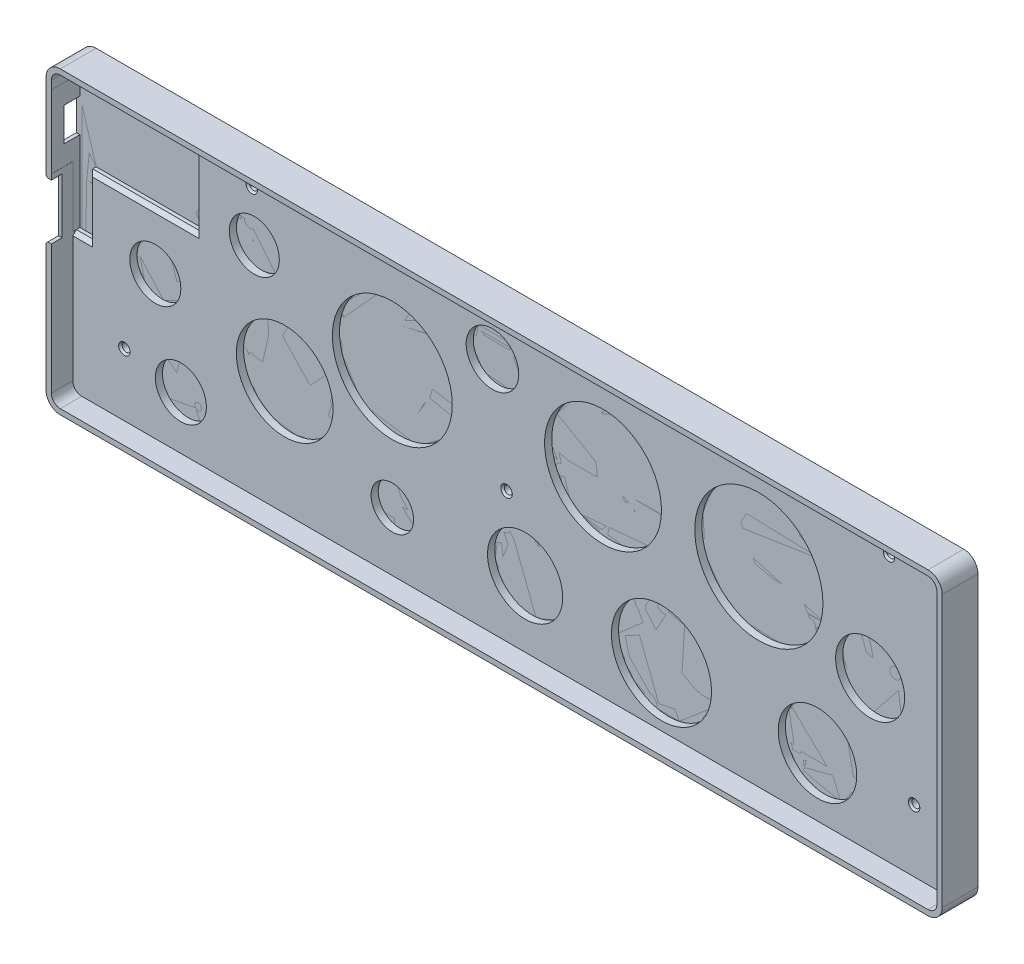
from build123d import *

# Parameters (mm, degrees)
SKETCH1_R                = 1.1
SKETCH1_R_2              = 0.95
SKETCH1_R_3              = 2.05
SKETCH1_R_4              = 1.5
SKETCH1_R_5              = 0.15
SKETCH1_R_6              = 0.5
SKETCH1_R_7              = 0.45
SKETCH1_R_8              = 1.524
SKETCH1_R_9              = 1.9939
SKETCH1_R_10             = 0.375
BOSS_EXTRUDE1_DEPTH      = 1.6
BOSS_EXTRUDE2_DEPTH      = 8
BOSS_EXTRUDE2_DEPTH_BACK = 2
BOSS_EXTRUDE5_DEPTH      = 2
BOSS_EXTRUDE5_DEPTH_BACK = 2
BOSS_EXTRUDE5_START      = 1.6
SKETCH5_R                = 1.105991344
SKETCH5_R_2              = 1.113799343
SKETCH5_R_3              = 1.1
SKETCH6_W                = 32.534762887
SKETCH6_H                = 20.354663213
CUT_EXTRUDE1_DEPTH       = 2
SKETCH7_W                = 2.5
SKETCH7_H                = 9.354663213
SKETCH7_W_2              = 2
CUT_EXTRUDE2_DEPTH       = 313.254874697
CUT_EXTRUDE3_DEPTH       = 10
CUT_EXTRUDE3_DEPTH_BACK  = 2
SKETCH9_W                = 4.56033848
SKETCH9_H                = 16.973436805
CUT_EXTRUDE4_DEPTH       = 2
SKETCH11_W               = 5
SKETCH11_H               = 15.458393228
CUT_EXTRUDE6_DEPTH       = 2
CHAMFER1_SIZE            = 0.5
CHAMFER2_SIZE            = 0.5
CHAMFER3_SIZE            = 1
CHAMFER4_SIZE            = 0.5
SKETCH14_R               = 7.140850868
SKETCH14_R_2             = 13.529089725
SKETCH14_R_3             = 16.769908871
SKETCH14_R_4             = 16.347261312
SKETCH14_R_5             = 14
SKETCH14_R_6             = 5.942662117
SKETCH14_R_7             = 10.51468553
SKETCH14_R_8             = 17.931561283
SKETCH14_R_9             = 10.983244874
SKETCH14_R_10            = 9.653898763
SKETCH14_R_11            = 7.356379062
SKETCH14_R_12            = 7.000760864
CUT_EXTRUDE8_DEPTH       = 2
CUT_EXTRUDE9_DEPTH       = 1


with BuildPart() as part:
    # Sketch1 → Boss-Extrude1 (new body)
    with BuildSketch(Plane.XY.offset(1.6)):
        with BuildLine():
            Line((342.620001494, -108.45), (99.949998506, -108.45))
            ThreePointArc((99.949998506, -108.45), (98.535786, -109.035786), (97.95, -110.449998506))
            Line((97.95, -110.449998506), (97.95, -186.250001494))
            ThreePointArc((97.95, -186.250001494), (98.535786, -187.664214), (99.949998506, -188.25))
            Line((99.949998506, -188.25), (342.620001494, -188.25))
            ThreePointArc((342.620001494, -188.25), (344.034214, -187.664214), (344.62, -186.250001494))
            Line((344.62, -186.250001494), (344.62, -110.449998506))
            ThreePointArc((344.62, -110.449998506), (344.034214, -109.035786), (342.620001494, -108.45))
        make_face()
        with Locations(Location((325.72, -114.3, 0), (0, 0, 180))):
            Circle(SKETCH1_R, mode=Mode.SUBTRACT)
        with Locations(Location((330.8, -120, 0), (0, 0, 180))):
            Circle(SKETCH1_R_2, mode=Mode.SUBTRACT)
        with Locations(Location((325.72, -120, 0), (0, 0, 180))):
            Circle(SKETCH1_R_3, mode=Mode.SUBTRACT)
        with Locations(Location((320.64, -120, 0), (0, 0, 180))):
            Circle(SKETCH1_R_2, mode=Mode.SUBTRACT)
        with Locations(Location((304.58, -120, 0), (0, 0, 180))):
            Circle(SKETCH1_R_2, mode=Mode.SUBTRACT)
        with Locations(Location((299.5, -120, 0), (0, 0, 180))):
            Circle(SKETCH1_R_3, mode=Mode.SUBTRACT)
        with Locations(Location((294.42, -120, 0), (0, 0, 180))):
            Circle(SKETCH1_R_2, mode=Mode.SUBTRACT)
        with Locations(Location((285.58, -120, 0), (0, 0, 180))):
            Circle(SKETCH1_R_2, mode=Mode.SUBTRACT)
        with Locations(Location((280.5, -120, 0), (0, 0, 180))):
            Circle(SKETCH1_R_3, mode=Mode.SUBTRACT)
        with Locations(Location((329.53, -122.54, 0), (0, 0, 180))):
            Circle(SKETCH1_R_4, mode=Mode.SUBTRACT)
        with Locations(Location((323.18, -125.08, 0), (0, 0, 180))):
            Circle(SKETCH1_R_4, mode=Mode.SUBTRACT)
        with Locations(Location((327.37, -129, 0), (0, 0, 180))):
            Circle(SKETCH1_R_5, mode=Mode.SUBTRACT)
        with Locations(Location((324.07, -129, 0), (0, 0, 180))):
            Circle(SKETCH1_R_5, mode=Mode.SUBTRACT)
        with Locations(Location((303.31, -122.54, 0), (0, 0, 180))):
            Circle(SKETCH1_R_4, mode=Mode.SUBTRACT)
        with Locations(Location((296.96, -125.08, 0), (0, 0, 180))):
            Circle(SKETCH1_R_4, mode=Mode.SUBTRACT)
        with Locations(Location((284.31, -122.54, 0), (0, 0, 180))):
            Circle(SKETCH1_R_4, mode=Mode.SUBTRACT)
        with Locations(Location((301.15, -129, 0), (0, 0, 180))):
            Circle(SKETCH1_R_5, mode=Mode.SUBTRACT)
        with Locations(Location((297.85, -129, 0), (0, 0, 180))):
            Circle(SKETCH1_R_5, mode=Mode.SUBTRACT)
        with Locations(Location((282.15, -129, 0), (0, 0, 180))):
            Circle(SKETCH1_R_5, mode=Mode.SUBTRACT)
        with Locations(Location((275.42, -120, 0), (0, 0, 180))):
            Circle(SKETCH1_R_2, mode=Mode.SUBTRACT)
        with Locations(Location((266.58, -120, 0), (0, 0, 180))):
            Circle(SKETCH1_R_2, mode=Mode.SUBTRACT)
        with Locations(Location((261.5, -120, 0), (0, 0, 180))):
            Circle(SKETCH1_R_3, mode=Mode.SUBTRACT)
        with Locations(Location((256.42, -120, 0), (0, 0, 180))):
            Circle(SKETCH1_R_2, mode=Mode.SUBTRACT)
        with Locations(Location((247.58, -120, 0), (0, 0, 180))):
            Circle(SKETCH1_R_2, mode=Mode.SUBTRACT)
        with Locations(Location((242.5, -120, 0), (0, 0, 180))):
            Circle(SKETCH1_R_3, mode=Mode.SUBTRACT)
        with Locations(Location((237.42, -120, 0), (0, 0, 180))):
            Circle(SKETCH1_R_2, mode=Mode.SUBTRACT)
        with Locations(Location((228.58, -120, 0), (0, 0, 180))):
            Circle(SKETCH1_R_2, mode=Mode.SUBTRACT)
        with Locations(Location((223.5, -120, 0), (0, 0, 180))):
            Circle(SKETCH1_R_3, mode=Mode.SUBTRACT)
        with Locations(Location((265.31, -122.54, 0), (0, 0, 180))):
            Circle(SKETCH1_R_4, mode=Mode.SUBTRACT)
        with Locations(Location((277.96, -125.08, 0), (0, 0, 180))):
            Circle(SKETCH1_R_4, mode=Mode.SUBTRACT)
        with Locations(Location((258.96, -125.08, 0), (0, 0, 180))):
            Circle(SKETCH1_R_4, mode=Mode.SUBTRACT)
        with Locations(Location((278.85, -129, 0), (0, 0, 180))):
            Circle(SKETCH1_R_5, mode=Mode.SUBTRACT)
        with Locations(Location((263.15, -129, 0), (0, 0, 180))):
            Circle(SKETCH1_R_5, mode=Mode.SUBTRACT)
        with Locations(Location((259.85, -129, 0), (0, 0, 180))):
            Circle(SKETCH1_R_5, mode=Mode.SUBTRACT)
        with Locations(Location((246.31, -122.54, 0), (0, 0, 180))):
            Circle(SKETCH1_R_4, mode=Mode.SUBTRACT)
        with Locations(Location((239.96, -125.08, 0), (0, 0, 180))):
            Circle(SKETCH1_R_4, mode=Mode.SUBTRACT)
        with Locations(Location((227.31, -122.54, 0), (0, 0, 180))):
            Circle(SKETCH1_R_4, mode=Mode.SUBTRACT)
        with Locations(Location((220.96, -125.08, 0), (0, 0, 180))):
            Circle(SKETCH1_R_4, mode=Mode.SUBTRACT)
        with Locations(Location((244.15, -129, 0), (0, 0, 180))):
            Circle(SKETCH1_R_5, mode=Mode.SUBTRACT)
        with Locations(Location((240.85, -129, 0), (0, 0, 180))):
            Circle(SKETCH1_R_5, mode=Mode.SUBTRACT)
        with Locations(Location((225.15, -129, 0), (0, 0, 180))):
            Circle(SKETCH1_R_5, mode=Mode.SUBTRACT)
        with Locations(Location((221.85, -129, 0), (0, 0, 180))):
            Circle(SKETCH1_R_5, mode=Mode.SUBTRACT)
        with Locations(Location((333.08, -139, 0), (0, 0, 180))):
            Circle(SKETCH1_R_2, mode=Mode.SUBTRACT)
        with Locations(Location((328, -139, 0), (0, 0, 180))):
            Circle(SKETCH1_R_3, mode=Mode.SUBTRACT)
        with Locations(Location((322.92, -139, 0), (0, 0, 180))):
            Circle(SKETCH1_R_2, mode=Mode.SUBTRACT)
        with Locations(Location((309.33, -139, 0), (0, 0, 180))):
            Circle(SKETCH1_R_2, mode=Mode.SUBTRACT)
        with Locations(Location((304.25, -139, 0), (0, 0, 180))):
            Circle(SKETCH1_R_3, mode=Mode.SUBTRACT)
        with Locations(Location((299.17, -139, 0), (0, 0, 180))):
            Circle(SKETCH1_R_2, mode=Mode.SUBTRACT)
        with Locations(Location((290.33, -139, 0), (0, 0, 180))):
            Circle(SKETCH1_R_2, mode=Mode.SUBTRACT)
        with Locations(Location((285.25, -139, 0), (0, 0, 180))):
            Circle(SKETCH1_R_3, mode=Mode.SUBTRACT)
        with Locations(Location((280.17, -139, 0), (0, 0, 180))):
            Circle(SKETCH1_R_2, mode=Mode.SUBTRACT)
        with Locations(Location((331.81, -141.54, 0), (0, 0, 180))):
            Circle(SKETCH1_R_4, mode=Mode.SUBTRACT)
        with Locations(Location((325.46, -144.08, 0), (0, 0, 180))):
            Circle(SKETCH1_R_4, mode=Mode.SUBTRACT)
        with Locations(Location((329.65, -148, 0), (0, 0, 180))):
            Circle(SKETCH1_R_5, mode=Mode.SUBTRACT)
        with Locations(Location((326.35, -148, 0), (0, 0, 180))):
            Circle(SKETCH1_R_5, mode=Mode.SUBTRACT)
        with Locations(Location((308.06, -141.54, 0), (0, 0, 180))):
            Circle(SKETCH1_R_4, mode=Mode.SUBTRACT)
        with Locations(Location((301.71, -144.08, 0), (0, 0, 180))):
            Circle(SKETCH1_R_4, mode=Mode.SUBTRACT)
        with Locations(Location((289.06, -141.54, 0), (0, 0, 180))):
            Circle(SKETCH1_R_4, mode=Mode.SUBTRACT)
        with Locations(Location((282.71, -144.08, 0), (0, 0, 180))):
            Circle(SKETCH1_R_4, mode=Mode.SUBTRACT)
        with Locations(Location((305.9, -148, 0), (0, 0, 180))):
            Circle(SKETCH1_R_5, mode=Mode.SUBTRACT)
        with Locations(Location((302.6, -148, 0), (0, 0, 180))):
            Circle(SKETCH1_R_5, mode=Mode.SUBTRACT)
        with Locations(Location((286.9, -148, 0), (0, 0, 180))):
            Circle(SKETCH1_R_5, mode=Mode.SUBTRACT)
        with Locations(Location((283.6, -148, 0), (0, 0, 180))):
            Circle(SKETCH1_R_5, mode=Mode.SUBTRACT)
        with Locations(Location((271.33, -139, 0), (0, 0, 180))):
            Circle(SKETCH1_R_2, mode=Mode.SUBTRACT)
        with Locations(Location((266.25, -139, 0), (0, 0, 180))):
            Circle(SKETCH1_R_3, mode=Mode.SUBTRACT)
        with Locations(Location((261.17, -139, 0), (0, 0, 180))):
            Circle(SKETCH1_R_2, mode=Mode.SUBTRACT)
        with Locations(Location((252.33, -139, 0), (0, 0, 180))):
            Circle(SKETCH1_R_2, mode=Mode.SUBTRACT)
        with Locations(Location((247.25, -139, 0), (0, 0, 180))):
            Circle(SKETCH1_R_3, mode=Mode.SUBTRACT)
        with Locations(Location((242.17, -139, 0), (0, 0, 180))):
            Circle(SKETCH1_R_2, mode=Mode.SUBTRACT)
        with Locations(Location((233.33, -139, 0), (0, 0, 180))):
            Circle(SKETCH1_R_2, mode=Mode.SUBTRACT)
        with Locations(Location((228.25, -139, 0), (0, 0, 180))):
            Circle(SKETCH1_R_3, mode=Mode.SUBTRACT)
        with Locations(Location((223.17, -139, 0), (0, 0, 180))):
            Circle(SKETCH1_R_2, mode=Mode.SUBTRACT)
        with Locations(Location((270.06, -141.54, 0), (0, 0, 180))):
            Circle(SKETCH1_R_4, mode=Mode.SUBTRACT)
        with Locations(Location((251.06, -141.54, 0), (0, 0, 180))):
            Circle(SKETCH1_R_4, mode=Mode.SUBTRACT)
        with Locations(Location((263.71, -144.08, 0), (0, 0, 180))):
            Circle(SKETCH1_R_4, mode=Mode.SUBTRACT)
        with Locations(Location((267.9, -148, 0), (0, 0, 180))):
            Circle(SKETCH1_R_5, mode=Mode.SUBTRACT)
        with Locations(Location((264.6, -148, 0), (0, 0, 180))):
            Circle(SKETCH1_R_5, mode=Mode.SUBTRACT)
        with Locations(Location((244.71, -144.08, 0), (0, 0, 180))):
            Circle(SKETCH1_R_4, mode=Mode.SUBTRACT)
        with Locations(Location((232.06, -141.54, 0), (0, 0, 180))):
            Circle(SKETCH1_R_4, mode=Mode.SUBTRACT)
        with Locations(Location((225.71, -144.08, 0), (0, 0, 180))):
            Circle(SKETCH1_R_4, mode=Mode.SUBTRACT)
        with Locations(Location((248.9, -148, 0), (0, 0, 180))):
            Circle(SKETCH1_R_5, mode=Mode.SUBTRACT)
        with Locations(Location((245.6, -148, 0), (0, 0, 180))):
            Circle(SKETCH1_R_5, mode=Mode.SUBTRACT)
        with Locations(Location((229.9, -148, 0), (0, 0, 180))):
            Circle(SKETCH1_R_5, mode=Mode.SUBTRACT)
        with Locations(Location((226.6, -148, 0), (0, 0, 180))):
            Circle(SKETCH1_R_5, mode=Mode.SUBTRACT)
        with Locations(Location((218.42, -120, 0), (0, 0, 180))):
            Circle(SKETCH1_R_2, mode=Mode.SUBTRACT)
        with Locations(Location((209.58, -120, 0), (0, 0, 180))):
            Circle(SKETCH1_R_2, mode=Mode.SUBTRACT)
        with Locations(Location((204.5, -120, 0), (0, 0, 180))):
            Circle(SKETCH1_R_3, mode=Mode.SUBTRACT)
        with Locations(Location((199.42, -120, 0), (0, 0, 180))):
            Circle(SKETCH1_R_2, mode=Mode.SUBTRACT)
        with Locations(Location((190.58, -120, 0), (0, 0, 180))):
            Circle(SKETCH1_R_2, mode=Mode.SUBTRACT)
        with Locations(Location((185.5, -120, 0), (0, 0, 180))):
            Circle(SKETCH1_R_3, mode=Mode.SUBTRACT)
        with Locations(Location((180.42, -120, 0), (0, 0, 180))):
            Circle(SKETCH1_R_2, mode=Mode.SUBTRACT)
        with Locations(Location((171.58, -120, 0), (0, 0, 180))):
            Circle(SKETCH1_R_2, mode=Mode.SUBTRACT)
        with Locations(Location((166.5, -120, 0), (0, 0, 180))):
            Circle(SKETCH1_R_3, mode=Mode.SUBTRACT)
        with Locations(Location((161.42, -120, 0), (0, 0, 180))):
            Circle(SKETCH1_R_2, mode=Mode.SUBTRACT)
        with Locations(Location((208.31, -122.54, 0), (0, 0, 180))):
            Circle(SKETCH1_R_4, mode=Mode.SUBTRACT)
        with Locations(Location((189.31, -122.54, 0), (0, 0, 180))):
            Circle(SKETCH1_R_4, mode=Mode.SUBTRACT)
        with Locations(Location((201.96, -125.08, 0), (0, 0, 180))):
            Circle(SKETCH1_R_4, mode=Mode.SUBTRACT)
        with Locations(Location((206.15, -129, 0), (0, 0, 180))):
            Circle(SKETCH1_R_5, mode=Mode.SUBTRACT)
        with Locations(Location((202.85, -129, 0), (0, 0, 180))):
            Circle(SKETCH1_R_5, mode=Mode.SUBTRACT)
        with Locations(Location((182.96, -125.08, 0), (0, 0, 180))):
            Circle(SKETCH1_R_4, mode=Mode.SUBTRACT)
        with Locations(Location((170.31, -122.54, 0), (0, 0, 180))):
            Circle(SKETCH1_R_4, mode=Mode.SUBTRACT)
        with Locations(Location((163.96, -125.08, 0), (0, 0, 180))):
            Circle(SKETCH1_R_4, mode=Mode.SUBTRACT)
        with Locations(Location((187.15, -129, 0), (0, 0, 180))):
            Circle(SKETCH1_R_5, mode=Mode.SUBTRACT)
        with Locations(Location((183.85, -129, 0), (0, 0, 180))):
            Circle(SKETCH1_R_5, mode=Mode.SUBTRACT)
        with Locations(Location((168.15, -129, 0), (0, 0, 180))):
            Circle(SKETCH1_R_5, mode=Mode.SUBTRACT)
        with Locations(Location((164.85, -129, 0), (0, 0, 180))):
            Circle(SKETCH1_R_5, mode=Mode.SUBTRACT)
        with Locations(Location((147.5, -114.3, 0), (0, 0, 180))):
            Circle(SKETCH1_R, mode=Mode.SUBTRACT)
        with Locations(Location((129.49, -115.23, 0), (0, 0, 180))):
            Circle(SKETCH1_R_6, mode=Mode.SUBTRACT)
        with Locations(Location((152.58, -120, 0), (0, 0, 180))):
            Circle(SKETCH1_R_2, mode=Mode.SUBTRACT)
        with Locations(Location((147.5, -120, 0), (0, 0, 180))):
            Circle(SKETCH1_R_3, mode=Mode.SUBTRACT)
        with Locations(Location((142.42, -120, 0), (0, 0, 180))):
            Circle(SKETCH1_R_2, mode=Mode.SUBTRACT)
        with Locations(Location((133.58, -120, 0), (0, 0, 180))):
            Circle(SKETCH1_R_2, mode=Mode.SUBTRACT)
        with Locations(Location((126.95, -115.23, 0), (0, 0, 180))):
            Circle(SKETCH1_R_6, mode=Mode.SUBTRACT)
        with Locations(Location((124.41, -115.23, 0), (0, 0, 180))):
            Circle(SKETCH1_R_6, mode=Mode.SUBTRACT)
        with Locations(Location((121.87, -115.23, 0), (0, 0, 180))):
            Circle(SKETCH1_R_6, mode=Mode.SUBTRACT)
        with Locations(Location((119.33, -115.23, 0), (0, 0, 180))):
            Circle(SKETCH1_R_6, mode=Mode.SUBTRACT)
        with Locations(Location((116.79, -115.23, 0), (0, 0, 180))):
            Circle(SKETCH1_R_6, mode=Mode.SUBTRACT)
        with Locations(Location((114.25, -115.23, 0), (0, 0, 180))):
            Circle(SKETCH1_R_6, mode=Mode.SUBTRACT)
        with Locations(Location((111.71, -115.23, 0), (0, 0, 180))):
            Circle(SKETCH1_R_6, mode=Mode.SUBTRACT)
        with Locations(Location((109.17, -115.23, 0), (0, 0, 180))):
            Circle(SKETCH1_R_6, mode=Mode.SUBTRACT)
        with Locations(Location((106.63, -115.23, 0), (0, 0, 180))):
            Circle(SKETCH1_R_6, mode=Mode.SUBTRACT)
        with Locations(Location((104.09, -115.23, 0), (0, 0, 180))):
            Circle(SKETCH1_R_6, mode=Mode.SUBTRACT)
        with Locations(Location((101.55, -115.23, 0), (0, 0, 180))):
            Circle(SKETCH1_R_6, mode=Mode.SUBTRACT)
        with Locations(Location((128.5, -120, 0), (0, 0, 180))):
            Circle(SKETCH1_R_3, mode=Mode.SUBTRACT)
        with Locations(Location((123.42, -120, 0), (0, 0, 180))):
            Circle(SKETCH1_R_2, mode=Mode.SUBTRACT)
        with Locations(Location((114.58, -120, 0), (0, 0, 180))):
            Circle(SKETCH1_R_2, mode=Mode.SUBTRACT)
        with Locations(Location((120.05, -121.150002, 0), (0, 0, 180))):
            Circle(SKETCH1_R_5, mode=Mode.SUBTRACT)
        with Locations(Location((109.5, -120, 0), (0, 0, 180))):
            Circle(SKETCH1_R_3, mode=Mode.SUBTRACT)
        with Locations(Location((104.42, -120, 0), (0, 0, 180))):
            Circle(SKETCH1_R_2, mode=Mode.SUBTRACT)
        with Locations(Location((100.875, -120.825002, 0), (0, 0, 180))):
            Circle(SKETCH1_R_5, mode=Mode.SUBTRACT)
        with Locations(Location((151.31, -122.54, 0), (0, 0, 180))):
            Circle(SKETCH1_R_4, mode=Mode.SUBTRACT)
        with Locations(Location((144.96, -125.08, 0), (0, 0, 180))):
            Circle(SKETCH1_R_4, mode=Mode.SUBTRACT)
        with Locations(Location((132.31, -122.54, 0), (0, 0, 180))):
            Circle(SKETCH1_R_4, mode=Mode.SUBTRACT)
        with Locations(Location((149.15, -129, 0), (0, 0, 180))):
            Circle(SKETCH1_R_5, mode=Mode.SUBTRACT)
        with Locations(Location((145.85, -129, 0), (0, 0, 180))):
            Circle(SKETCH1_R_5, mode=Mode.SUBTRACT)
        with Locations(Location((129.49, -130.47, 0), (0, 0, 180))):
            Circle(SKETCH1_R_6, mode=Mode.SUBTRACT)
        with Locations(Location((120.05, -124.449998, 0), (0, 0, 180))):
            Circle(SKETCH1_R_5, mode=Mode.SUBTRACT)
        with Locations(Location((125.96, -125.08, 0), (0, 0, 180))):
            Circle(SKETCH1_R_4, mode=Mode.SUBTRACT)
        with Locations(Location((113.31, -122.54, 0), (0, 0, 180))):
            Circle(SKETCH1_R_4, mode=Mode.SUBTRACT)
        with Locations(Location((100.875, -124.124998, 0), (0, 0, 180))):
            Circle(SKETCH1_R_5, mode=Mode.SUBTRACT)
        with Locations(Location((106.96, -125.08, 0), (0, 0, 180))):
            Circle(SKETCH1_R_4, mode=Mode.SUBTRACT)
        with Locations(Location((126.95, -130.47, 0), (0, 0, 180))):
            Circle(SKETCH1_R_6, mode=Mode.SUBTRACT)
        with Locations(Location((124.41, -130.47, 0), (0, 0, 180))):
            Circle(SKETCH1_R_6, mode=Mode.SUBTRACT)
        with Locations(Location((121.87, -130.47, 0), (0, 0, 180))):
            Circle(SKETCH1_R_6, mode=Mode.SUBTRACT)
        with Locations(Location((119.33, -130.47, 0), (0, 0, 180))):
            Circle(SKETCH1_R_6, mode=Mode.SUBTRACT)
        with Locations(Location((116.79, -130.47, 0), (0, 0, 180))):
            Circle(SKETCH1_R_6, mode=Mode.SUBTRACT)
        with Locations(Location((114.25, -130.47, 0), (0, 0, 180))):
            Circle(SKETCH1_R_6, mode=Mode.SUBTRACT)
        with Locations(Location((111.71, -130.47, 0), (0, 0, 180))):
            Circle(SKETCH1_R_6, mode=Mode.SUBTRACT)
        with Locations(Location((109.17, -130.47, 0), (0, 0, 180))):
            Circle(SKETCH1_R_6, mode=Mode.SUBTRACT)
        with Locations(Location((106.63, -130.47, 0), (0, 0, 180))):
            Circle(SKETCH1_R_6, mode=Mode.SUBTRACT)
        with Locations(Location((104.09, -130.47, 0), (0, 0, 180))):
            Circle(SKETCH1_R_6, mode=Mode.SUBTRACT)
        with Locations(Location((101.55, -130.47, 0), (0, 0, 180))):
            Circle(SKETCH1_R_6, mode=Mode.SUBTRACT)
        with Locations(Location((214.33, -139, 0), (0, 0, 180))):
            Circle(SKETCH1_R_2, mode=Mode.SUBTRACT)
        with Locations(Location((209.25, -139, 0), (0, 0, 180))):
            Circle(SKETCH1_R_3, mode=Mode.SUBTRACT)
        with Locations(Location((204.17, -139, 0), (0, 0, 180))):
            Circle(SKETCH1_R_2, mode=Mode.SUBTRACT)
        with Locations(Location((195.33, -139, 0), (0, 0, 180))):
            Circle(SKETCH1_R_2, mode=Mode.SUBTRACT)
        with Locations(Location((190.25, -139, 0), (0, 0, 180))):
            Circle(SKETCH1_R_3, mode=Mode.SUBTRACT)
        with Locations(Location((185.17, -139, 0), (0, 0, 180))):
            Circle(SKETCH1_R_2, mode=Mode.SUBTRACT)
        with Locations(Location((176.33, -139, 0), (0, 0, 180))):
            Circle(SKETCH1_R_2, mode=Mode.SUBTRACT)
        with Locations(Location((171.25, -139, 0), (0, 0, 180))):
            Circle(SKETCH1_R_3, mode=Mode.SUBTRACT)
        with Locations(Location((166.17, -139, 0), (0, 0, 180))):
            Circle(SKETCH1_R_2, mode=Mode.SUBTRACT)
        with Locations(Location((213.06, -141.54, 0), (0, 0, 180))):
            Circle(SKETCH1_R_4, mode=Mode.SUBTRACT)
        with Locations(Location((206.71, -144.08, 0), (0, 0, 180))):
            Circle(SKETCH1_R_4, mode=Mode.SUBTRACT)
        with Locations(Location((194.06, -141.54, 0), (0, 0, 180))):
            Circle(SKETCH1_R_4, mode=Mode.SUBTRACT)
        with Locations(Location((210.9, -148, 0), (0, 0, 180))):
            Circle(SKETCH1_R_5, mode=Mode.SUBTRACT)
        with Locations(Location((207.6, -148, 0), (0, 0, 180))):
            Circle(SKETCH1_R_5, mode=Mode.SUBTRACT)
        with Locations(Location((191.9, -148, 0), (0, 0, 180))):
            Circle(SKETCH1_R_5, mode=Mode.SUBTRACT)
        with Locations(Location((175.06, -141.54, 0), (0, 0, 180))):
            Circle(SKETCH1_R_4, mode=Mode.SUBTRACT)
        with Locations(Location((187.71, -144.08, 0), (0, 0, 180))):
            Circle(SKETCH1_R_4, mode=Mode.SUBTRACT)
        with Locations(Location((168.71, -144.08, 0), (0, 0, 180))):
            Circle(SKETCH1_R_4, mode=Mode.SUBTRACT)
        with Locations(Location((188.6, -148, 0), (0, 0, 180))):
            Circle(SKETCH1_R_5, mode=Mode.SUBTRACT)
        with Locations(Location((172.9, -148, 0), (0, 0, 180))):
            Circle(SKETCH1_R_5, mode=Mode.SUBTRACT)
        with Locations(Location((169.6, -148, 0), (0, 0, 180))):
            Circle(SKETCH1_R_5, mode=Mode.SUBTRACT)
        with Locations(Location((157.33, -139, 0), (0, 0, 180))):
            Circle(SKETCH1_R_2, mode=Mode.SUBTRACT)
        with Locations(Location((152.25, -139, 0), (0, 0, 180))):
            Circle(SKETCH1_R_3, mode=Mode.SUBTRACT)
        with Locations(Location((147.17, -139, 0), (0, 0, 180))):
            Circle(SKETCH1_R_2, mode=Mode.SUBTRACT)
        with Locations(Location((138.33, -139, 0), (0, 0, 180))):
            Circle(SKETCH1_R_2, mode=Mode.SUBTRACT)
        with Locations(Location((133.25, -139, 0), (0, 0, 180))):
            Circle(SKETCH1_R_3, mode=Mode.SUBTRACT)
        with Locations(Location((128.17, -139, 0), (0, 0, 180))):
            Circle(SKETCH1_R_2, mode=Mode.SUBTRACT)
        with Locations(Location((116.955, -139, 0), (0, 0, 180))):
            Circle(SKETCH1_R_2, mode=Mode.SUBTRACT)
        with Locations(Location((99.78, -137.775, 0), (0, 0, 180))):
            Circle(SKETCH1_R_7, mode=Mode.SUBTRACT)
        with Locations(Location((111.875, -139, 0), (0, 0, 180))):
            Circle(SKETCH1_R_3, mode=Mode.SUBTRACT)
        with Locations(Location((106.795, -139, 0), (0, 0, 180))):
            Circle(SKETCH1_R_2, mode=Mode.SUBTRACT)
        with Locations(Location((99.78, -140.775, 0), (0, 0, 180))):
            Circle(SKETCH1_R_7, mode=Mode.SUBTRACT)
        with Locations(Location((156.06, -141.54, 0), (0, 0, 180))):
            Circle(SKETCH1_R_4, mode=Mode.SUBTRACT)
        with Locations(Location((149.71, -144.08, 0), (0, 0, 180))):
            Circle(SKETCH1_R_4, mode=Mode.SUBTRACT)
        with Locations(Location((137.06, -141.54, 0), (0, 0, 180))):
            Circle(SKETCH1_R_4, mode=Mode.SUBTRACT)
        with Locations(Location((130.71, -144.08, 0), (0, 0, 180))):
            Circle(SKETCH1_R_4, mode=Mode.SUBTRACT)
        with Locations(Location((153.9, -148, 0), (0, 0, 180))):
            Circle(SKETCH1_R_5, mode=Mode.SUBTRACT)
        with Locations(Location((150.6, -148, 0), (0, 0, 180))):
            Circle(SKETCH1_R_5, mode=Mode.SUBTRACT)
        with Locations(Location((134.9, -148, 0), (0, 0, 180))):
            Circle(SKETCH1_R_5, mode=Mode.SUBTRACT)
        with Locations(Location((131.6, -148, 0), (0, 0, 180))):
            Circle(SKETCH1_R_5, mode=Mode.SUBTRACT)
        with Locations(Location((115.685, -141.54, 0), (0, 0, 180))):
            Circle(SKETCH1_R_4, mode=Mode.SUBTRACT)
        with Locations(Location((109.335, -144.08, 0), (0, 0, 180))):
            Circle(SKETCH1_R_4, mode=Mode.SUBTRACT)
        with Locations(Location((113.525, -148, 0), (0, 0, 180))):
            Circle(SKETCH1_R_5, mode=Mode.SUBTRACT)
        with Locations(Location((110.225, -148, 0), (0, 0, 180))):
            Circle(SKETCH1_R_5, mode=Mode.SUBTRACT)
        with Locations(Location((337.83, -158, 0), (0, 0, 180))):
            Circle(SKETCH1_R_2, mode=Mode.SUBTRACT)
        with Locations(Location((332.75, -158, 0), (0, 0, 180))):
            Circle(SKETCH1_R_3, mode=Mode.SUBTRACT)
        with Locations(Location((327.67, -158, 0), (0, 0, 180))):
            Circle(SKETCH1_R_2, mode=Mode.SUBTRACT)
        with Locations(Location((318.83, -158, 0), (0, 0, 180))):
            Circle(SKETCH1_R_2, mode=Mode.SUBTRACT)
        with Locations(Location((313.75, -158, 0), (0, 0, 180))):
            Circle(SKETCH1_R_3, mode=Mode.SUBTRACT)
        with Locations(Location((308.67, -158, 0), (0, 0, 180))):
            Circle(SKETCH1_R_2, mode=Mode.SUBTRACT)
        with Locations(Location((299.83, -158, 0), (0, 0, 180))):
            Circle(SKETCH1_R_2, mode=Mode.SUBTRACT)
        with Locations(Location((294.75, -158, 0), (0, 0, 180))):
            Circle(SKETCH1_R_3, mode=Mode.SUBTRACT)
        with Locations(Location((289.67, -158, 0), (0, 0, 180))):
            Circle(SKETCH1_R_2, mode=Mode.SUBTRACT)
        with Locations(Location((280.83, -158, 0), (0, 0, 180))):
            Circle(SKETCH1_R_2, mode=Mode.SUBTRACT)
        with Locations(Location((336.56, -160.54, 0), (0, 0, 180))):
            Circle(SKETCH1_R_4, mode=Mode.SUBTRACT)
        with Locations(Location((330.21, -163.08, 0), (0, 0, 180))):
            Circle(SKETCH1_R_4, mode=Mode.SUBTRACT)
        with Locations(Location((317.56, -160.54, 0), (0, 0, 180))):
            Circle(SKETCH1_R_4, mode=Mode.SUBTRACT)
        with Locations(Location((311.21, -163.08, 0), (0, 0, 180))):
            Circle(SKETCH1_R_4, mode=Mode.SUBTRACT)
        with Locations(Location((334.4, -167, 0), (0, 0, 180))):
            Circle(SKETCH1_R_5, mode=Mode.SUBTRACT)
        with Locations(Location((331.1, -167, 0), (0, 0, 180))):
            Circle(SKETCH1_R_5, mode=Mode.SUBTRACT)
        with Locations(Location((315.4, -167, 0), (0, 0, 180))):
            Circle(SKETCH1_R_5, mode=Mode.SUBTRACT)
        with Locations(Location((312.1, -167, 0), (0, 0, 180))):
            Circle(SKETCH1_R_5, mode=Mode.SUBTRACT)
        with Locations(Location((298.56, -160.54, 0), (0, 0, 180))):
            Circle(SKETCH1_R_4, mode=Mode.SUBTRACT)
        with Locations(Location((279.56, -160.54, 0), (0, 0, 180))):
            Circle(SKETCH1_R_4, mode=Mode.SUBTRACT)
        with Locations(Location((292.21, -163.08, 0), (0, 0, 180))):
            Circle(SKETCH1_R_4, mode=Mode.SUBTRACT)
        with Locations(Location((296.4, -167, 0), (0, 0, 180))):
            Circle(SKETCH1_R_5, mode=Mode.SUBTRACT)
        with Locations(Location((293.1, -167, 0), (0, 0, 180))):
            Circle(SKETCH1_R_5, mode=Mode.SUBTRACT)
        with Locations(Location((275.75, -158, 0), (0, 0, 180))):
            Circle(SKETCH1_R_3, mode=Mode.SUBTRACT)
        with Locations(Location((270.67, -158, 0), (0, 0, 180))):
            Circle(SKETCH1_R_2, mode=Mode.SUBTRACT)
        with Locations(Location((261.83, -158, 0), (0, 0, 180))):
            Circle(SKETCH1_R_2, mode=Mode.SUBTRACT)
        with Locations(Location((256.75, -158, 0), (0, 0, 180))):
            Circle(SKETCH1_R_3, mode=Mode.SUBTRACT)
        with Locations(Location((251.67, -158, 0), (0, 0, 180))):
            Circle(SKETCH1_R_2, mode=Mode.SUBTRACT)
        with Locations(Location((242.83, -158, 0), (0, 0, 180))):
            Circle(SKETCH1_R_2, mode=Mode.SUBTRACT)
        with Locations(Location((237.75, -158, 0), (0, 0, 180))):
            Circle(SKETCH1_R_3, mode=Mode.SUBTRACT)
        with Locations(Location((232.67, -158, 0), (0, 0, 180))):
            Circle(SKETCH1_R_2, mode=Mode.SUBTRACT)
        with Locations(Location((223.83, -158, 0), (0, 0, 180))):
            Circle(SKETCH1_R_2, mode=Mode.SUBTRACT)
        with Locations(Location((273.21, -163.08, 0), (0, 0, 180))):
            Circle(SKETCH1_R_4, mode=Mode.SUBTRACT)
        with Locations(Location((260.56, -160.54, 0), (0, 0, 180))):
            Circle(SKETCH1_R_4, mode=Mode.SUBTRACT)
        with Locations(Location((254.21, -163.08, 0), (0, 0, 180))):
            Circle(SKETCH1_R_4, mode=Mode.SUBTRACT)
        with Locations(Location((277.4, -167, 0), (0, 0, 180))):
            Circle(SKETCH1_R_5, mode=Mode.SUBTRACT)
        with Locations(Location((274.1, -167, 0), (0, 0, 180))):
            Circle(SKETCH1_R_5, mode=Mode.SUBTRACT)
        with Locations(Location((258.4, -167, 0), (0, 0, 180))):
            Circle(SKETCH1_R_5, mode=Mode.SUBTRACT)
        with Locations(Location((255.1, -167, 0), (0, 0, 180))):
            Circle(SKETCH1_R_5, mode=Mode.SUBTRACT)
        with Locations(Location((241.56, -160.54, 0), (0, 0, 180))):
            Circle(SKETCH1_R_4, mode=Mode.SUBTRACT)
        with Locations(Location((235.21, -163.08, 0), (0, 0, 180))):
            Circle(SKETCH1_R_4, mode=Mode.SUBTRACT)
        with Locations(Location((222.56, -160.54, 0), (0, 0, 180))):
            Circle(SKETCH1_R_4, mode=Mode.SUBTRACT)
        with Locations(Location((239.4, -167, 0), (0, 0, 180))):
            Circle(SKETCH1_R_5, mode=Mode.SUBTRACT)
        with Locations(Location((236.1, -167, 0), (0, 0, 180))):
            Circle(SKETCH1_R_5, mode=Mode.SUBTRACT)
        with Locations(Location((220.4, -167, 0), (0, 0, 180))):
            Circle(SKETCH1_R_5, mode=Mode.SUBTRACT)
        with Locations(Location((332.75, -171.3, 0), (0, 0, 180))):
            Circle(SKETCH1_R, mode=Mode.SUBTRACT)
        with Locations(Location((337.83, -177, 0), (0, 0, 180))):
            Circle(SKETCH1_R_2, mode=Mode.SUBTRACT)
        with Locations(Location((332.75, -177, 0), (0, 0, 180))):
            Circle(SKETCH1_R_3, mode=Mode.SUBTRACT)
        with Locations(Location((327.67, -177, 0), (0, 0, 180))):
            Circle(SKETCH1_R_2, mode=Mode.SUBTRACT)
        with Locations(Location((318.83, -177, 0), (0, 0, 180))):
            Circle(SKETCH1_R_2, mode=Mode.SUBTRACT)
        with Locations(Location((313.75, -177, 0), (0, 0, 180))):
            Circle(SKETCH1_R_3, mode=Mode.SUBTRACT)
        with Locations(Location((308.67, -177, 0), (0, 0, 180))):
            Circle(SKETCH1_R_2, mode=Mode.SUBTRACT)
        with Locations(Location((299.83, -177, 0), (0, 0, 180))):
            Circle(SKETCH1_R_2, mode=Mode.SUBTRACT)
        with Locations(Location((294.75, -177, 0), (0, 0, 180))):
            Circle(SKETCH1_R_3, mode=Mode.SUBTRACT)
        with Locations(Location((289.67, -177, 0), (0, 0, 180))):
            Circle(SKETCH1_R_2, mode=Mode.SUBTRACT)
        with Locations(Location((280.83, -177, 0), (0, 0, 180))):
            Circle(SKETCH1_R_2, mode=Mode.SUBTRACT)
        with Locations(Location((336.56, -179.54, 0), (0, 0, 180))):
            Circle(SKETCH1_R_4, mode=Mode.SUBTRACT)
        with Locations(Location((330.21, -182.08, 0), (0, 0, 180))):
            Circle(SKETCH1_R_4, mode=Mode.SUBTRACT)
        with Locations(Location((317.56, -179.54, 0), (0, 0, 180))):
            Circle(SKETCH1_R_4, mode=Mode.SUBTRACT)
        with Locations(Location((311.21, -182.08, 0), (0, 0, 180))):
            Circle(SKETCH1_R_4, mode=Mode.SUBTRACT)
        with Locations(Location((334.4, -186, 0), (0, 0, 180))):
            Circle(SKETCH1_R_5, mode=Mode.SUBTRACT)
        with Locations(Location((331.1, -186, 0), (0, 0, 180))):
            Circle(SKETCH1_R_5, mode=Mode.SUBTRACT)
        with Locations(Location((315.4, -186, 0), (0, 0, 180))):
            Circle(SKETCH1_R_5, mode=Mode.SUBTRACT)
        with Locations(Location((312.1, -186, 0), (0, 0, 180))):
            Circle(SKETCH1_R_5, mode=Mode.SUBTRACT)
        with Locations(Location((298.56, -179.54, 0), (0, 0, 180))):
            Circle(SKETCH1_R_4, mode=Mode.SUBTRACT)
        with Locations(Location((279.56, -179.54, 0), (0, 0, 180))):
            Circle(SKETCH1_R_4, mode=Mode.SUBTRACT)
        with Locations(Location((292.21, -182.08, 0), (0, 0, 180))):
            Circle(SKETCH1_R_4, mode=Mode.SUBTRACT)
        with Locations(Location((296.4, -186, 0), (0, 0, 180))):
            Circle(SKETCH1_R_5, mode=Mode.SUBTRACT)
        with Locations(Location((293.1, -186, 0), (0, 0, 180))):
            Circle(SKETCH1_R_5, mode=Mode.SUBTRACT)
        with Locations(Location((256.813, -170.015, 0), (0, 0, 180))):
            Circle(SKETCH1_R_8, mode=Mode.SUBTRACT)
        with Locations(Location((275.75, -177, 0), (0, 0, 180))):
            Circle(SKETCH1_R_3, mode=Mode.SUBTRACT)
        with Locations(Location((270.67, -177, 0), (0, 0, 180))):
            Circle(SKETCH1_R_2, mode=Mode.SUBTRACT)
        with Locations(Location((249.955, -177, 0), (0, 0, 180))):
            Circle(SKETCH1_R_2, mode=Mode.SUBTRACT)
        with Locations(Location((232.937, -170.015, 0), (0, 0, 180))):
            Circle(SKETCH1_R_8, mode=Mode.SUBTRACT)
        with Locations(Location((244.875, -177, 0), (0, 0, 180))):
            Circle(SKETCH1_R_3, mode=Mode.SUBTRACT)
        with Locations(Location((239.795, -177, 0), (0, 0, 180))):
            Circle(SKETCH1_R_2, mode=Mode.SUBTRACT)
        with Locations(Location((273.21, -182.08, 0), (0, 0, 180))):
            Circle(SKETCH1_R_4, mode=Mode.SUBTRACT)
        with Locations(Location((277.4, -186, 0), (0, 0, 180))):
            Circle(SKETCH1_R_5, mode=Mode.SUBTRACT)
        with Locations(Location((274.1, -186, 0), (0, 0, 180))):
            Circle(SKETCH1_R_5, mode=Mode.SUBTRACT)
        with Locations(Location((256.813, -185.225, 0), (0, 0, 180))):
            Circle(SKETCH1_R_9, mode=Mode.SUBTRACT)
        with Locations(Location((248.685, -179.54, 0), (0, 0, 180))):
            Circle(SKETCH1_R_4, mode=Mode.SUBTRACT)
        with Locations(Location((242.335, -182.08, 0), (0, 0, 180))):
            Circle(SKETCH1_R_4, mode=Mode.SUBTRACT)
        with Locations(Location((246.525, -186, 0), (0, 0, 180))):
            Circle(SKETCH1_R_5, mode=Mode.SUBTRACT)
        with Locations(Location((243.225, -186, 0), (0, 0, 180))):
            Circle(SKETCH1_R_5, mode=Mode.SUBTRACT)
        with Locations(Location((232.937, -185.225, 0), (0, 0, 180))):
            Circle(SKETCH1_R_9, mode=Mode.SUBTRACT)
        with Locations(Location((218.75, -152.3, 0), (0, 0, 180))):
            Circle(SKETCH1_R, mode=Mode.SUBTRACT)
        with Locations(Location((218.75, -158, 0), (0, 0, 180))):
            Circle(SKETCH1_R_3, mode=Mode.SUBTRACT)
        with Locations(Location((213.67, -158, 0), (0, 0, 180))):
            Circle(SKETCH1_R_2, mode=Mode.SUBTRACT)
        with Locations(Location((204.83, -158, 0), (0, 0, 180))):
            Circle(SKETCH1_R_2, mode=Mode.SUBTRACT)
        with Locations(Location((199.75, -158, 0), (0, 0, 180))):
            Circle(SKETCH1_R_3, mode=Mode.SUBTRACT)
        with Locations(Location((194.67, -158, 0), (0, 0, 180))):
            Circle(SKETCH1_R_2, mode=Mode.SUBTRACT)
        with Locations(Location((185.83, -158, 0), (0, 0, 180))):
            Circle(SKETCH1_R_2, mode=Mode.SUBTRACT)
        with Locations(Location((180.75, -158, 0), (0, 0, 180))):
            Circle(SKETCH1_R_3, mode=Mode.SUBTRACT)
        with Locations(Location((175.67, -158, 0), (0, 0, 180))):
            Circle(SKETCH1_R_2, mode=Mode.SUBTRACT)
        with Locations(Location((166.83, -158, 0), (0, 0, 180))):
            Circle(SKETCH1_R_2, mode=Mode.SUBTRACT)
        with Locations(Location((161.75, -158, 0), (0, 0, 180))):
            Circle(SKETCH1_R_3, mode=Mode.SUBTRACT)
        with Locations(Location((216.21, -163.08, 0), (0, 0, 180))):
            Circle(SKETCH1_R_4, mode=Mode.SUBTRACT)
        with Locations(Location((203.56, -160.54, 0), (0, 0, 180))):
            Circle(SKETCH1_R_4, mode=Mode.SUBTRACT)
        with Locations(Location((197.21, -163.08, 0), (0, 0, 180))):
            Circle(SKETCH1_R_4, mode=Mode.SUBTRACT)
        with Locations(Location((217.1, -167, 0), (0, 0, 180))):
            Circle(SKETCH1_R_5, mode=Mode.SUBTRACT)
        with Locations(Location((201.4, -167, 0), (0, 0, 180))):
            Circle(SKETCH1_R_5, mode=Mode.SUBTRACT)
        with Locations(Location((198.1, -167, 0), (0, 0, 180))):
            Circle(SKETCH1_R_5, mode=Mode.SUBTRACT)
        with Locations(Location((184.56, -160.54, 0), (0, 0, 180))):
            Circle(SKETCH1_R_4, mode=Mode.SUBTRACT)
        with Locations(Location((178.21, -163.08, 0), (0, 0, 180))):
            Circle(SKETCH1_R_4, mode=Mode.SUBTRACT)
        with Locations(Location((165.56, -160.54, 0), (0, 0, 180))):
            Circle(SKETCH1_R_4, mode=Mode.SUBTRACT)
        with Locations(Location((159.21, -163.08, 0), (0, 0, 180))):
            Circle(SKETCH1_R_4, mode=Mode.SUBTRACT)
        with Locations(Location((182.4, -167, 0), (0, 0, 180))):
            Circle(SKETCH1_R_5, mode=Mode.SUBTRACT)
        with Locations(Location((179.1, -167, 0), (0, 0, 180))):
            Circle(SKETCH1_R_5, mode=Mode.SUBTRACT)
        with Locations(Location((163.4, -167, 0), (0, 0, 180))):
            Circle(SKETCH1_R_5, mode=Mode.SUBTRACT)
        with Locations(Location((160.1, -167, 0), (0, 0, 180))):
            Circle(SKETCH1_R_5, mode=Mode.SUBTRACT)
        with Locations(Location((130.6, -154.325, 0), (0, 0, 180))):
            Circle(SKETCH1_R_10, mode=Mode.SUBTRACT)
        with Locations(Location((156.67, -158, 0), (0, 0, 180))):
            Circle(SKETCH1_R_2, mode=Mode.SUBTRACT)
        with Locations(Location((147.83, -158, 0), (0, 0, 180))):
            Circle(SKETCH1_R_2, mode=Mode.SUBTRACT)
        with Locations(Location((142.75, -158, 0), (0, 0, 180))):
            Circle(SKETCH1_R_3, mode=Mode.SUBTRACT)
        with Locations(Location((137.67, -158, 0), (0, 0, 180))):
            Circle(SKETCH1_R_2, mode=Mode.SUBTRACT)
        with Locations(Location((128.6, -154.325, 0), (0, 0, 180))):
            Circle(SKETCH1_R_10, mode=Mode.SUBTRACT)
        with Locations(Location((121.705, -158, 0), (0, 0, 180))):
            Circle(SKETCH1_R_2, mode=Mode.SUBTRACT)
        with Locations(Location((116.625, -158, 0), (0, 0, 180))):
            Circle(SKETCH1_R_3, mode=Mode.SUBTRACT)
        with Locations(Location((111.545, -158, 0), (0, 0, 180))):
            Circle(SKETCH1_R_2, mode=Mode.SUBTRACT)
        with Locations(Location((146.56, -160.54, 0), (0, 0, 180))):
            Circle(SKETCH1_R_4, mode=Mode.SUBTRACT)
        with Locations(Location((140.21, -163.08, 0), (0, 0, 180))):
            Circle(SKETCH1_R_4, mode=Mode.SUBTRACT)
        with Locations(Location((144.4, -167, 0), (0, 0, 180))):
            Circle(SKETCH1_R_5, mode=Mode.SUBTRACT)
        with Locations(Location((141.1, -167, 0), (0, 0, 180))):
            Circle(SKETCH1_R_5, mode=Mode.SUBTRACT)
        with Locations(Location((120.435, -160.54, 0), (0, 0, 180))):
            Circle(SKETCH1_R_4, mode=Mode.SUBTRACT)
        with Locations(Location((114.085, -163.08, 0), (0, 0, 180))):
            Circle(SKETCH1_R_4, mode=Mode.SUBTRACT)
        with Locations(Location((118.275, -167, 0), (0, 0, 180))):
            Circle(SKETCH1_R_5, mode=Mode.SUBTRACT)
        with Locations(Location((114.975, -167, 0), (0, 0, 180))):
            Circle(SKETCH1_R_5, mode=Mode.SUBTRACT)
        with Locations(Location((209.313, -170.04, 0), (0, 0, 180))):
            Circle(SKETCH1_R_8, mode=Mode.SUBTRACT)
        with Locations(Location((202.455, -177, 0), (0, 0, 180))):
            Circle(SKETCH1_R_2, mode=Mode.SUBTRACT)
        with Locations(Location((197.375, -177, 0), (0, 0, 180))):
            Circle(SKETCH1_R_3, mode=Mode.SUBTRACT)
        with Locations(Location((192.295, -177, 0), (0, 0, 180))):
            Circle(SKETCH1_R_2, mode=Mode.SUBTRACT)
        with Locations(Location((185.437, -170.04, 0), (0, 0, 180))):
            Circle(SKETCH1_R_8, mode=Mode.SUBTRACT)
        with Locations(Location((164.455, -177, 0), (0, 0, 180))):
            Circle(SKETCH1_R_2, mode=Mode.SUBTRACT)
        with Locations(Location((159.375, -177, 0), (0, 0, 180))):
            Circle(SKETCH1_R_3, mode=Mode.SUBTRACT)
        with Locations(Location((201.185, -179.54, 0), (0, 0, 180))):
            Circle(SKETCH1_R_4, mode=Mode.SUBTRACT)
        with Locations(Location((194.835, -182.08, 0), (0, 0, 180))):
            Circle(SKETCH1_R_4, mode=Mode.SUBTRACT)
        with Locations(Location((209.313, -185.25, 0), (0, 0, 180))):
            Circle(SKETCH1_R_9, mode=Mode.SUBTRACT)
        with Locations(Location((199.025, -186, 0), (0, 0, 180))):
            Circle(SKETCH1_R_5, mode=Mode.SUBTRACT)
        with Locations(Location((195.725, -186, 0), (0, 0, 180))):
            Circle(SKETCH1_R_5, mode=Mode.SUBTRACT)
        with Locations(Location((163.185, -179.54, 0), (0, 0, 180))):
            Circle(SKETCH1_R_4, mode=Mode.SUBTRACT)
        with Locations(Location((185.437, -185.25, 0), (0, 0, 180))):
            Circle(SKETCH1_R_9, mode=Mode.SUBTRACT)
        with Locations(Location((161.025, -186, 0), (0, 0, 180))):
            Circle(SKETCH1_R_5, mode=Mode.SUBTRACT)
        with Locations(Location((154.295, -177, 0), (0, 0, 180))):
            Circle(SKETCH1_R_2, mode=Mode.SUBTRACT)
        with Locations(Location((140.705, -177, 0), (0, 0, 180))):
            Circle(SKETCH1_R_2, mode=Mode.SUBTRACT)
        with Locations(Location((135.625, -177, 0), (0, 0, 180))):
            Circle(SKETCH1_R_3, mode=Mode.SUBTRACT)
        with Locations(Location((130.545, -177, 0), (0, 0, 180))):
            Circle(SKETCH1_R_2, mode=Mode.SUBTRACT)
        with Locations(Location((111.875, -171.3, 0), (0, 0, 180))):
            Circle(SKETCH1_R, mode=Mode.SUBTRACT)
        with Locations(Location((116.955, -177, 0), (0, 0, 180))):
            Circle(SKETCH1_R_2, mode=Mode.SUBTRACT)
        with Locations(Location((111.875, -177, 0), (0, 0, 180))):
            Circle(SKETCH1_R_3, mode=Mode.SUBTRACT)
        with Locations(Location((106.795, -177, 0), (0, 0, 180))):
            Circle(SKETCH1_R_2, mode=Mode.SUBTRACT)
        with Locations(Location((156.835, -182.08, 0), (0, 0, 180))):
            Circle(SKETCH1_R_4, mode=Mode.SUBTRACT)
        with Locations(Location((139.435, -179.54, 0), (0, 0, 180))):
            Circle(SKETCH1_R_4, mode=Mode.SUBTRACT)
        with Locations(Location((133.085, -182.08, 0), (0, 0, 180))):
            Circle(SKETCH1_R_4, mode=Mode.SUBTRACT)
        with Locations(Location((157.725, -186, 0), (0, 0, 180))):
            Circle(SKETCH1_R_5, mode=Mode.SUBTRACT)
        with Locations(Location((137.275, -186, 0), (0, 0, 180))):
            Circle(SKETCH1_R_5, mode=Mode.SUBTRACT)
        with Locations(Location((133.975, -186, 0), (0, 0, 180))):
            Circle(SKETCH1_R_5, mode=Mode.SUBTRACT)
        with Locations(Location((115.685, -179.54, 0), (0, 0, 180))):
            Circle(SKETCH1_R_4, mode=Mode.SUBTRACT)
        with Locations(Location((109.335, -182.08, 0), (0, 0, 180))):
            Circle(SKETCH1_R_4, mode=Mode.SUBTRACT)
        with Locations(Location((113.525, -186, 0), (0, 0, 180))):
            Circle(SKETCH1_R_5, mode=Mode.SUBTRACT)
        with Locations(Location((110.225, -186, 0), (0, 0, 180))):
            Circle(SKETCH1_R_5, mode=Mode.SUBTRACT)
    extrude(amount=-BOSS_EXTRUDE1_DEPTH)


with BuildPart() as body_2:
    # Sketch2 → Boss-Extrude2 (new, two sides: drawn at the far end of the back side and taken through both)
    with BuildSketch(Plane.XY.offset(1.6).offset(-BOSS_EXTRUDE2_DEPTH_BACK)):
        with BuildLine():
            Line((99.949998506, -106.45), (342.620001494, -106.45))
            ThreePointArc((342.620001494, -106.45), (345.448427562, -107.621572438), (346.62, -110.449998506))
            Line((346.62, -110.449998506), (346.62, -186.250001494))
            ThreePointArc((346.62, -186.250001494), (345.448427562, -189.078427562), (342.620001494, -190.25))
            Line((342.620001494, -190.25), (99.949998506, -190.25))
            ThreePointArc((99.949998506, -190.25), (97.121572438, -189.078427562), (95.95, -186.250001494))
            Line((95.95, -186.250001494), (95.95, -110.449998506))
            ThreePointArc((95.95, -110.449998506), (97.121572438, -107.621572438), (99.949998506, -106.45))
        make_face()
        with BuildLine():
            Line((99.949998506, -107.95), (342.620001494, -107.95))
            ThreePointArc((342.620001494, -107.95), (344.387767391, -108.682232609), (345.12, -110.449998506))
            Line((345.12, -110.449998506), (345.12, -186.250001494))
            ThreePointArc((345.12, -186.250001494), (344.387767391, -188.017767391), (342.620001494, -188.75))
            Line((342.620001494, -188.75), (99.949998506, -188.75))
            ThreePointArc((99.949998506, -188.75), (98.182232609, -188.017767391), (97.45, -186.250001494))
            Line((97.45, -186.250001494), (97.45, -110.449998506))
            ThreePointArc((97.45, -110.449998506), (98.182232609, -108.682232609), (99.949998506, -107.95))
        make_face(mode=Mode.SUBTRACT)
    extrude(amount=BOSS_EXTRUDE2_DEPTH + BOSS_EXTRUDE2_DEPTH_BACK)

    # Sketch5 → Boss-Extrude5 (add, two sides: drawn at the far end of the back side and taken through both)
    with BuildSketch(Plane.XY.offset(BOSS_EXTRUDE5_START - BOSS_EXTRUDE5_DEPTH_BACK)):
        with BuildLine():
            Line((342.620001494, -107.95), (99.949998506, -107.95))
            ThreePointArc((99.949998506, -107.95), (98.182232609, -108.682232609), (97.45, -110.449998506))
            Line((97.45, -110.449998506), (97.45, -186.250001494))
            ThreePointArc((97.45, -186.250001494), (98.182232609, -188.017767391), (99.949998506, -188.75))
            Line((99.949998506, -188.75), (342.620001494, -188.75))
            ThreePointArc((342.620001494, -188.75), (344.387767391, -188.017767391), (345.12, -186.250001494))
            Line((345.12, -186.250001494), (345.12, -110.449998506))
            ThreePointArc((345.12, -110.449998506), (344.387767391, -108.682232609), (342.620001494, -107.95))
        make_face()
        with Locations((111.875, -171.3)):
            Circle(SKETCH5_R, mode=Mode.SUBTRACT)
        with Locations((218.75, -152.3)):
            Circle(SKETCH5_R_2, mode=Mode.SUBTRACT)
        with Locations((332.75, -171.3)):
            Circle(SKETCH5_R_3, mode=Mode.SUBTRACT)
        with Locations((147.5, -114.3)):
            Circle(SKETCH5_R_3, mode=Mode.SUBTRACT)
        with Locations((325.72, -114.3)):
            Circle(SKETCH5_R_3, mode=Mode.SUBTRACT)
    extrude(amount=BOSS_EXTRUDE5_DEPTH + BOSS_EXTRUDE5_DEPTH_BACK)

    # Sketch6 → Cut-Extrude1 (cut)
    with BuildSketch(Plane.XY.offset(3.6)):
        with Locations((115.468941808, -122.970077656)):
            Rectangle(SKETCH6_W, SKETCH6_H)
    extrude(amount=-CUT_EXTRUDE1_DEPTH, mode=Mode.SUBTRACT)

    # Sketch7 → Cut-Extrude2 (cut, through all)
    with BuildSketch(Plane(origin=(99.201560364, 0, 0), x_dir=(0, 0, -1), z_dir=(1, 0, 0))):
        with Locations((-4.85, -122.970077656)):
            Rectangle(SKETCH7_W, SKETCH7_H)
        with Locations((-2.6, -122.970077656)):
            Rectangle(SKETCH7_W_2, SKETCH7_H)
    extrude(amount=-CUT_EXTRUDE2_DEPTH, mode=Mode.SUBTRACT)

    # Sketch8 → Cut-Extrude3 (cut, two sides: drawn at the far end of the back side and taken through both)
    with BuildSketch(Plane.XY.offset(3.6).offset(-CUT_EXTRUDE3_DEPTH_BACK)):
        Polygon((99.201560364, -112.792746049), (97.439270013, -112.792746049), (97.439270013, -133.154581373), (99.201560364, -133.147409262), align=None)
    extrude(amount=CUT_EXTRUDE3_DEPTH + CUT_EXTRUDE3_DEPTH_BACK, mode=Mode.SUBTRACT)

    # Sketch9 → Cut-Extrude4 (cut)
    with BuildSketch(Plane.XY.offset(3.6)):
        with Locations((99.719439253, -141.634127664)):
            Rectangle(SKETCH9_W, SKETCH9_H)
    extrude(amount=-CUT_EXTRUDE4_DEPTH, mode=Mode.SUBTRACT)

    # Sketch11 → Cut-Extrude6 (cut)
    with BuildSketch(Plane(origin=(97.95, 0, 0), x_dir=(0, 0, -1), z_dir=(1, 0, 0))):
        with Locations((-9.1, -142.384615413)):
            Rectangle(SKETCH11_W, SKETCH11_H)
    extrude(amount=-CUT_EXTRUDE6_DEPTH, mode=Mode.SUBTRACT)

    # Chamfer1
    chamfer1_edges = [body_2.edges().sort_by_distance(p)[0] for p in [
        (95.95, -150.113812027, 8.1),
        (95.95, -134.655418799, 8.1),
        (95.95, -142.384615413, 6.6),
    ]]
    chamfer(chamfer1_edges, length=CHAMFER1_SIZE)

    # Chamfer2
    chamfer2_edges = [body_2.edges().sort_by_distance(p)[0] for p in [
        (95.95, -118.292746049, 3.85),
        (95.95, -122.970077655, 1.6),
        (95.95, -122.970077655, 6.1),
        (95.95, -127.647409262, 3.85),
    ]]
    chamfer(chamfer2_edges, length=CHAMFER2_SIZE)

    # Chamfer3
    chamfer3_edges = [body_2.edges().sort_by_distance(p)[0] for p in [
        (131.736323251, -122.970077655, 3.6),
        (114.593161626, -112.792746049, 3.6),
        (116.867965872, -133.147409262, 3.6),
        (99.724804246, -150.120846067, 3.6),
        (101.999608493, -141.634127664, 3.6),
    ]]
    chamfer(chamfer3_edges, length=CHAMFER3_SIZE)

    # Chamfer4
    chamfer4_edges = [body_2.edges().sort_by_distance(p)[0] for p in [
        (324.62, -114.3, 3.6),
        (331.65, -171.3, 3.6),
        (217.636200657, -152.3, 3.6),
        (110.769008656, -171.3, 3.6),
        (146.4, -114.3, 3.6),
    ]]
    chamfer(chamfer4_edges, length=CHAMFER4_SIZE)

    # Sketch14 → Cut-Extrude8 (cut)
    with BuildSketch(Plane.XY.offset(3.6)):
        with Locations((127.662740086, -173.926149902)):
            Circle(SKETCH14_R)
        with Locations((156.716486906, -156.701428574)):
            Circle(SKETCH14_R_2)
        with Locations((186.80786754, -139.061653719)):
            Circle(SKETCH14_R_3)
        with Locations((245.74546823, -135.326171985)):
            Circle(SKETCH14_R_4)
        with Locations((262.092729542, -172.265935798)):
            Circle(SKETCH14_R_5)
        with Locations((186.80786754, -172.265935798)):
            Circle(SKETCH14_R_6)
        with Locations((223.955158116, -170.230518298)):
            Circle(SKETCH14_R_7)
        with Locations((289.326088459, -135.326171985)):
            Circle(SKETCH14_R_8)
        with Locations((305.720702735, -172.265935798)):
            Circle(SKETCH14_R_9)
        with Locations((320.455102908, -146.74014395)):
            Circle(SKETCH14_R_10)
        with Locations((214.823980544, -122.291744848)):
            Circle(SKETCH14_R_11)
        with Locations((148.207889623, -128.062735281)):
            Circle(SKETCH14_R_12)
        with Locations((120.521889219, -148.81541158)):
            Circle(SKETCH14_R)
    extrude(amount=-CUT_EXTRUDE8_DEPTH, mode=Mode.SUBTRACT)

    # Sketch15 → Cut-Extrude9 (cut)
    with BuildSketch(Plane(origin=(0, 0, -0.4), x_dir=(-1, 0, 0), z_dir=(0, 0, -1))):
        with BuildLine():
            ThreePointArc((-340.620001494, -186.250001494), (-341.205787932, -184.835787932), (-342.620001494, -184.250001494))
            Line((-342.620001494, -184.250001494), (-342.620001494, -186.250001494))
            Line((-342.620001494, -186.250001494), (-340.620001494, -186.250001494))
        make_face()
        with BuildLine():
            Line((-342.620001494, -186.250001494), (-342.620001494, -184.250001494))
            ThreePointArc((-342.620001494, -184.250001494), (-344.034215057, -187.664215056), (-340.620001494, -186.250001494))
            Line((-340.620001494, -186.250001494), (-342.620001494, -186.250001494))
        make_face()
        with BuildLine():
            Line((-342.620001494, -112.449998506), (-342.620001494, -110.449998506))
            Line((-342.620001494, -110.449998506), (-340.620001494, -110.449998506))
            ThreePointArc((-340.620001494, -110.449998506), (-344.034215057, -109.035784943), (-342.620001494, -112.449998506))
        make_face()
        with BuildLine():
            Line((-340.620001494, -110.449998506), (-342.620001494, -110.449998506))
            Line((-342.620001494, -110.449998506), (-342.620001494, -112.449998506))
            ThreePointArc((-342.620001494, -112.449998506), (-341.205787932, -111.864212068), (-340.620001494, -110.449998506))
        make_face()
        with BuildLine():
            ThreePointArc((-97.949998506, -110.449998506), (-99.949998506, -108.449998506), (-101.949998506, -110.449998506))
            Line((-101.949998506, -110.449998506), (-99.949998506, -110.449998506))
            Line((-99.949998506, -110.449998506), (-99.949998506, -112.449998506))
            ThreePointArc((-99.949998506, -112.449998506), (-98.535784944, -111.864212068), (-97.949998506, -110.449998506))
        make_face()
        with BuildLine():
            Line((-99.949998506, -110.449998506), (-101.949998506, -110.449998506))
            ThreePointArc((-101.949998506, -110.449998506), (-101.364212068, -111.864212068), (-99.949998506, -112.449998506))
            Line((-99.949998506, -112.449998506), (-99.949998506, -110.449998506))
        make_face()
        with BuildLine():
            ThreePointArc((-97.949998506, -186.250001494), (-98.535784944, -184.835787932), (-99.949998506, -184.250001494))
            Line((-99.949998506, -184.250001494), (-99.949998506, -186.250001494))
            Line((-99.949998506, -186.250001494), (-101.949998506, -186.250001494))
            ThreePointArc((-101.949998506, -186.250001494), (-99.949998506, -188.250001494), (-97.949998506, -186.250001494))
        make_face()
        with BuildLine():
            Line((-99.949998506, -186.250001494), (-99.949998506, -184.250001494))
            ThreePointArc((-99.949998506, -184.250001494), (-101.364212068, -184.835787932), (-101.949998506, -186.250001494))
            Line((-101.949998506, -186.250001494), (-99.949998506, -186.250001494))
        make_face()
    extrude(amount=-CUT_EXTRUDE9_DEPTH, mode=Mode.SUBTRACT)


solid = Compound([part.part, body_2.part])
